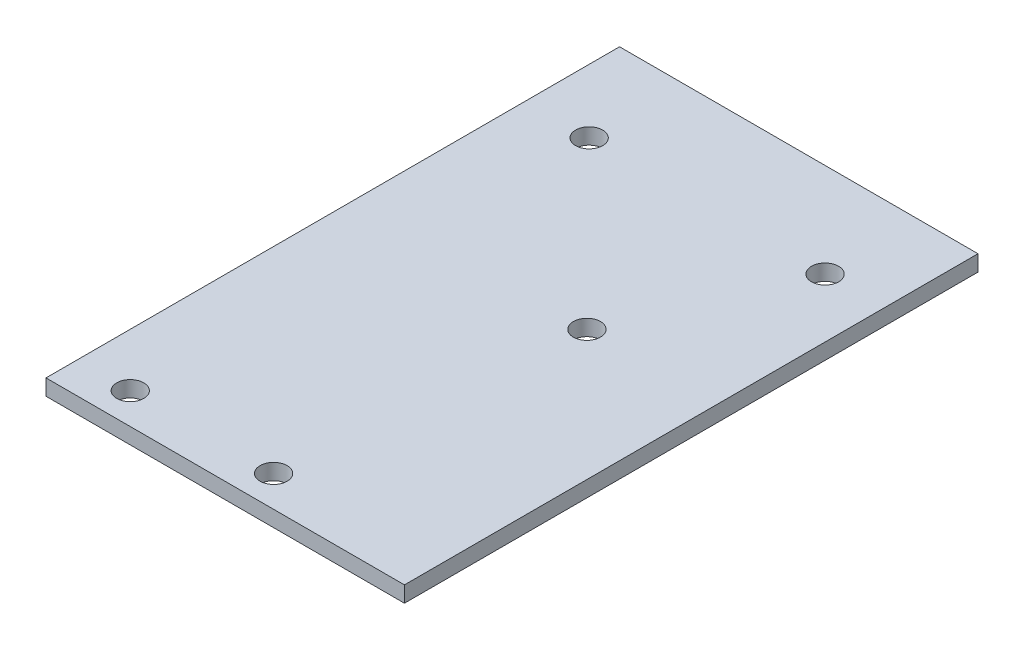
from build123d import *

# Parameters (mm, degrees)
SKETCH1_W                = 45
SKETCH1_H                = 72
BASE_FLANGE1_DEPTH       = 2
NEED_TO_REPOSITION_D     = 3.4
NEED_TO_REPOSITION_DEPTH = 12
NEED_TO_REPOSITION_TIP   = 1.021463052


# Sheet-metal steps are written as plain solids
with BuildPart() as part:
    # Sketch1 → Base-Flange1 (new body)
    with BuildSketch(Plane(origin=(0, 0, 0), x_dir=(1, 0, 0), z_dir=(0, 1, 0))):
        Rectangle(SKETCH1_W, SKETCH1_H)
    extrude(amount=-BASE_FLANGE1_DEPTH)

    # Need to Reposition
    with Locations(Plane(origin=(0, -2, 0), x_dir=(-1, 0, 0), z_dir=(0, -1, 0))):
        with Locations((-2.172321578, -32.098), (15.827678422, -32.098), (-6.172321578, 3.23), (-15.109631715, 24.190770957), (14.504316145, 24.190770957)):
            Hole(NEED_TO_REPOSITION_D / 2, depth=NEED_TO_REPOSITION_DEPTH)
            with Locations((0, 0, -(NEED_TO_REPOSITION_DEPTH + NEED_TO_REPOSITION_TIP / 2))):  # 118° drill point
                Cone(0, NEED_TO_REPOSITION_D / 2, NEED_TO_REPOSITION_TIP, mode=Mode.SUBTRACT)


solid = part.part
